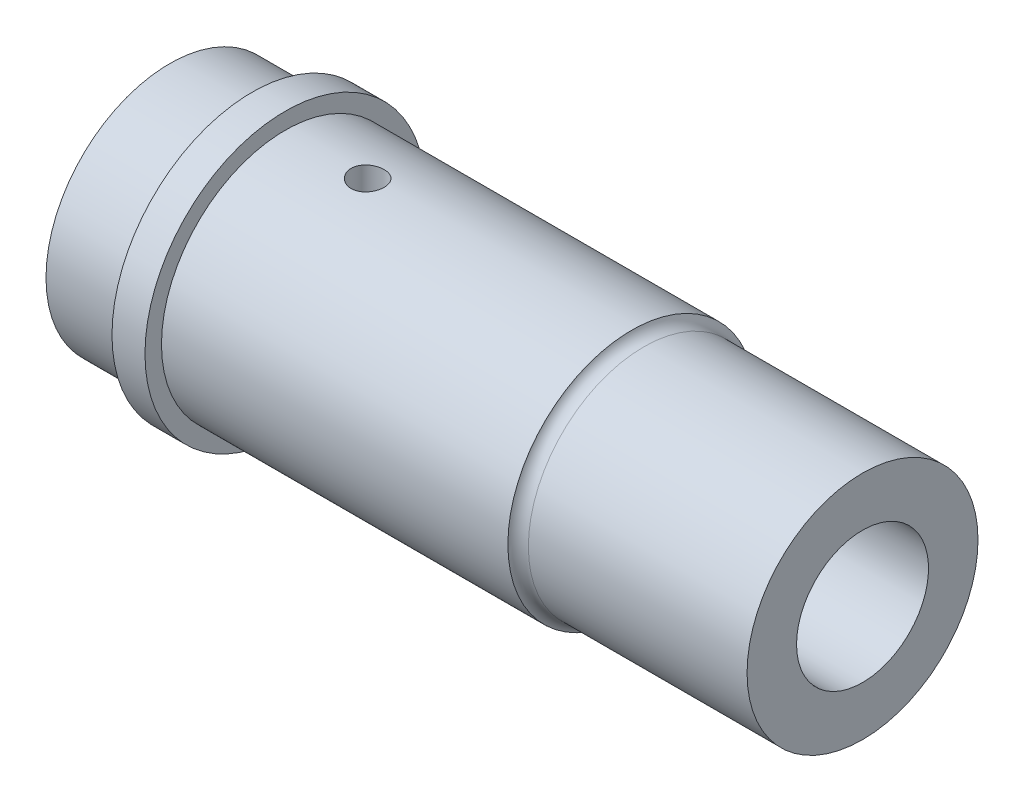
from build123d import *

# Parameters (mm, degrees)
SKETCH1_R               = 7.5
BOSS_EXTRUDE1_DEPTH     = 5
SKETCH2_R               = 8.5
BOSS_EXTRUDE2_DEPTH     = 2
SKETCH3_R               = 7.5
BOSS_EXTRUDE3_DEPTH     = 35
SKETCH4_R               = 4
CUT_EXTRUDE1_DEPTH      = 44.686382318
CUT_EXTRUDE3_REACH      = 47.741
CUT_EXTRUDE3_END_RADIUS = 4
SKETCH7_R               = 1
CUT_EXTRUDE6_START      = -14
SKETCH9_R               = 7.5
SKETCH9_R_2             = 7
CUT_EXTRUDE6_DEPTH      = 14
FILLET1_R               = 0.8
SKETCH10_W              = 3
SKETCH10_H              = 3
CUT_EXTRUDE7_DEPTH      = 28
SKETCH12_W              = 5
SKETCH12_H              = 5
CUT_EXTRUDE8_DEPTH      = 18.5


with BuildPart() as part:
    # Sketch1 → Boss-Extrude1 (new body)
    with BuildSketch(Plane(origin=(0, 0, 0), x_dir=(0, 0, -1), z_dir=(1, 0, 0))):
        Circle(SKETCH1_R)
    extrude(amount=BOSS_EXTRUDE1_DEPTH)

    # Sketch2 → Boss-Extrude2 (add)
    with BuildSketch(Plane(origin=(5, 0, 0), x_dir=(0, 0, -1), z_dir=(1, 0, 0))):
        Circle(SKETCH2_R)
    extrude(amount=BOSS_EXTRUDE2_DEPTH)

    # Sketch3 → Boss-Extrude3 (add)
    with BuildSketch(Plane(origin=(7, 0, 0), x_dir=(0, 0, -1), z_dir=(1, 0, 0))):
        Circle(SKETCH3_R)
    extrude(amount=BOSS_EXTRUDE3_DEPTH)

    # Sketch4 → Cut-Extrude1 (cut, through all)
    with BuildSketch(Plane.ZY):
        Circle(SKETCH4_R)
    extrude(amount=-CUT_EXTRUDE1_DEPTH, mode=Mode.SUBTRACT)

    # Cut-Extrude3: up to this cylinder (the profile starts outside it)
    cut_extrude3_end = Plane(origin=(12, 0, 0), z_dir=(-1, 0, 0)) * Cylinder(CUT_EXTRUDE3_END_RADIUS, 104.482, mode=Mode.PRIVATE)
    # Sketch7 → Cut-Extrude3 (cut, up to the surface)
    with BuildSketch(Plane(origin=(0, 7.5, 0), x_dir=(1, 0, 0), z_dir=(0, 1, 0)), mode=Mode.PRIVATE) as cut_extrude3_sk1:
        with Locations(Location((12, 0, 0), (0, 0, 270))):
            Circle(SKETCH7_R)
    cut_extrude3_tool1 = extrude(cut_extrude3_sk1.sketch, amount=-CUT_EXTRUDE3_REACH, mode=Mode.PRIVATE) - cut_extrude3_end
    add(cut_extrude3_tool1.solids().sort_by_distance((12, 7.5, 0))[0], mode=Mode.SUBTRACT)

    # Sketch9 → Cut-Extrude6 (cut)
    with BuildSketch(Plane(origin=(42, 0, 0), x_dir=(0, 0, -1), z_dir=(1, 0, 0)).offset(CUT_EXTRUDE6_START)):
        Circle(SKETCH9_R)
        Circle(SKETCH9_R_2, mode=Mode.SUBTRACT)
    extrude(amount=CUT_EXTRUDE6_DEPTH, mode=Mode.SUBTRACT)

    # Fillet1
    # the kernel refuses this fillet: 0.8 mm, written as the material it adds along each edge
    with BuildSketch(Plane(origin=(28, 0, 0), x_dir=(0, 0, -1), z_dir=(0, -1, 0))) as fillet1_piece_1:
        with BuildLine():
            CenterArc((7.8, 0.741619849), FILLET1_R, 180, 67.975687163)
            Line((7, 0.741619849), (6.984, 0.741619849))
            Line((6.984, 0.741619849), (6.984, 0))
            Line((6.984, 0), (7, -0.016))
            ThreePointArc((7, -0.016), (7.25, -0.016), (7.494, -0.014832397))
            Line((7.494, -0.014832397), (7.5, 0))
        make_face()
    revolve(axis=Axis((28, 0, 0), (1, 0, 0)))

    # Sketch10 → Cut-Extrude7 (cut)
    with BuildSketch(Plane.ZY):
        with Locations((0, 4)):
            Rectangle(SKETCH10_W, SKETCH10_H)
    extrude(amount=-CUT_EXTRUDE7_DEPTH, mode=Mode.SUBTRACT)

    # Sketch12 → Cut-Extrude8 (cut)
    with BuildSketch(Plane(origin=(27, 0, 0), x_dir=(0, 0, -1), z_dir=(1, 0, 0))):
        with Locations((0, -7.5)):
            Rectangle(SKETCH12_W, SKETCH12_H)
    extrude(amount=-CUT_EXTRUDE8_DEPTH, mode=Mode.SUBTRACT)


solid = part.part
